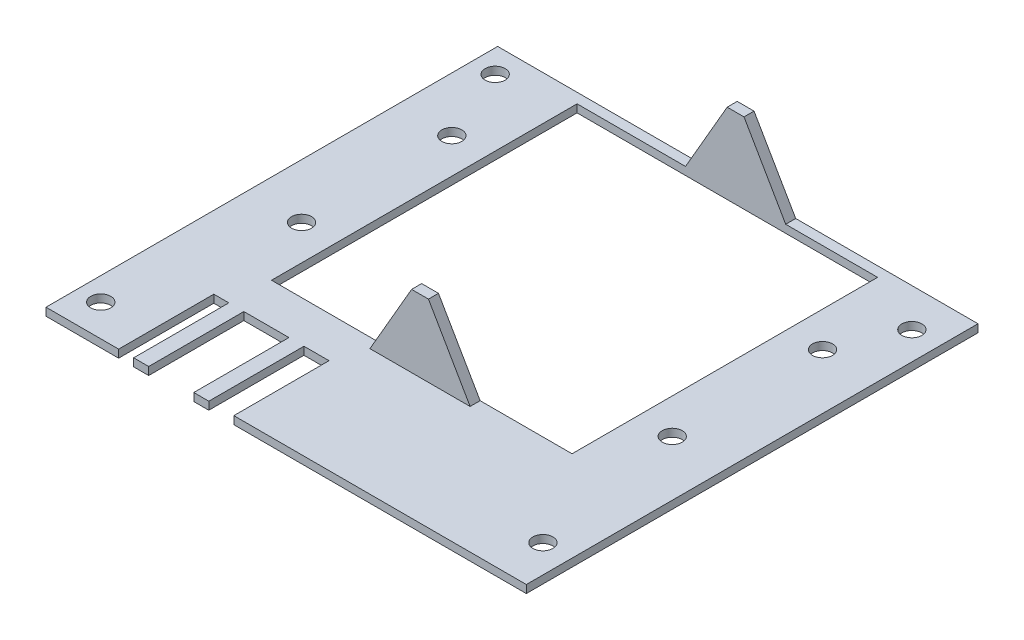
from build123d import *

# Parameters (mm, degrees)
SKETCH1_W               = 96.89
SKETCH1_H               = 90.17
PCB_DEPTH               = 1.57
SKETCH2_R               = 2
M3_MOUNTING_HOLES_DEPTH = 1.57
SKETCH4_R               = 2
CUT_EXTRUDE1_DEPTH      = 23
BOSS_EXTRUDE2_DEPTH     = 2
BOSS_EXTRUDE3_DEPTH     = 2
SKETCH9_W               = 3
SKETCH9_H               = 19
SKETCH9_W_2             = 9
SKETCH9_W_3             = 5
CUT_EXTRUDE2_DEPTH      = 128.304608561
SKETCH10_W              = 0.5
SKETCH10_H              = 90.17
CUT_EXTRUDE3_DEPTH      = 10
SKETCH11_W              = 60
SKETCH11_H              = 61
CUT_EXTRUDE4_DEPTH      = 10


with BuildPart() as part:
    # Sketch1 → PCB (new body)
    with BuildSketch(Plane(origin=(0, 0, 0), x_dir=(1, 0, 0), z_dir=(0, 1, 0))):
        with Locations((16.200949951, 63.633996534)):
            Rectangle(SKETCH1_W, SKETCH1_H)
    extrude(amount=PCB_DEPTH)

    # Sketch2 → M3 Mounting Holes (cut)
    with BuildSketch(Plane(origin=(0, 1.57, 0), x_dir=(1, 0, 0), z_dir=(0, 1, 0))):
        with Locations((58.565949951, 27.438996534)):
            Circle(SKETCH2_R)
        with Locations((-27.164050049, 24.898996534)):
            Circle(SKETCH2_R)
        with Locations((-27.164050049, 103.638996534)):
            Circle(SKETCH2_R)
        with Locations((58.565949951, 101.098996534)):
            Circle(SKETCH2_R)
    extrude(amount=-M3_MOUNTING_HOLES_DEPTH, mode=Mode.SUBTRACT)

    # Sketch4 → Cut-Extrude1 (cut)
    with BuildSketch(Plane(origin=(0, 1.57, 0), x_dir=(1, 0, 0), z_dir=(0, 1, 0))):
        with Locations((-20.894050049, 88.718996534)):
            Circle(SKETCH4_R)
        with Locations((53.105949951, 88.718996534)):
            Circle(SKETCH4_R)
        with Locations((-20.894050049, 58.718996534)):
            Circle(SKETCH4_R)
        with Locations((53.105949951, 58.718996534)):
            Circle(SKETCH4_R)
    extrude(amount=-CUT_EXTRUDE1_DEPTH, mode=Mode.SUBTRACT)

    # Sketch7 → Boss-Extrude2 (add)
    with BuildSketch(Plane.XY.offset(-45.718996534)):
        Polygon((27.755949951, 1.57), (19.438412086, 15.976398176), (16.073487816, 15.976398176), (7.755949951, 1.57), align=None)
    extrude(amount=BOSS_EXTRUDE2_DEPTH)

    # Sketch8 → Boss-Extrude3 (add)
    with BuildSketch(Plane.XY.offset(-108.718996534)):
        Polygon((27.755949951, 1.57), (19.438412086, 15.976398176), (16.073487816, 15.976398176), (7.755949951, 1.57), align=None)
    extrude(amount=BOSS_EXTRUDE3_DEPTH)

    # Sketch9 → Cut-Extrude2 (cut, through all)
    with BuildSketch(Plane(origin=(0, 1.57, 0), x_dir=(1, 0, 0), z_dir=(0, 1, 0))):
        with Locations((-15.744050049, 28.048996534)):
            Rectangle(SKETCH9_W, SKETCH9_H)
        with Locations((-6.744050049, 28.048996534)):
            Rectangle(SKETCH9_W_2, SKETCH9_H)
        with Locations((3.255949951, 28.048996534)):
            Rectangle(SKETCH9_W_3, SKETCH9_H)
    extrude(amount=-CUT_EXTRUDE2_DEPTH, mode=Mode.SUBTRACT)

    # Sketch10 → Cut-Extrude3 (cut)
    with BuildSketch(Plane(origin=(0, 1.57, 0), x_dir=(1, 0, 0), z_dir=(0, 1, 0))):
        with Locations((-31.994050049, 63.633996534)):
            Rectangle(SKETCH10_W, SKETCH10_H)
        with Locations((64.395949951, 63.633996534)):
            Rectangle(SKETCH10_W, SKETCH10_H)
    extrude(amount=-CUT_EXTRUDE3_DEPTH, mode=Mode.SUBTRACT)

    # Sketch11 → Cut-Extrude4 (cut)
    with BuildSketch(Plane(origin=(0, 1.57, 0), x_dir=(1, 0, 0), z_dir=(0, 1, 0))):
        with Locations((16.105949951, 76.218996534)):
            Rectangle(SKETCH11_W, SKETCH11_H)
    extrude(amount=-CUT_EXTRUDE4_DEPTH, mode=Mode.SUBTRACT)


solid = part.part
